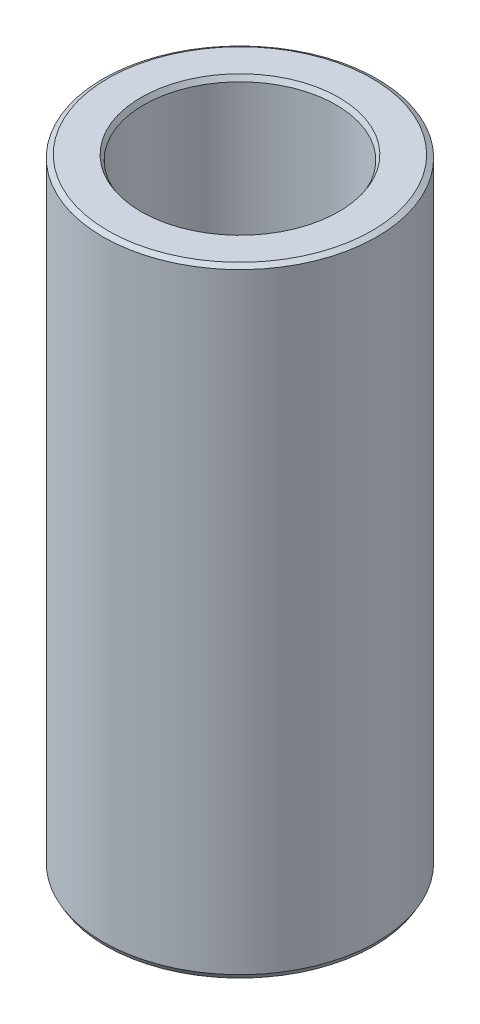
from build123d import *
from OCP.BRepFilletAPI import BRepFilletAPI_MakeChamfer

# Parameters (mm, degrees)
SKETCH1_R           = 42.5
BOSS_EXTRUDE1_DEPTH = 191.894333335
SKETCH2_R           = 29.814766012
CUT_EXTRUDE1_DEPTH  = 202.086884619
CHAMFER1_SIZE       = 0.885749775
CHAMFER1_SIZE2      = 1.534163613


with BuildPart() as part:
    # Sketch1 → Boss-Extrude1 (new body)
    with BuildSketch(Plane(origin=(0, 0, 0), x_dir=(1, 0, 0), z_dir=(0, 1, 0))):
        Circle(SKETCH1_R)
    extrude(amount=BOSS_EXTRUDE1_DEPTH)

    # Sketch2 → Cut-Extrude1 (cut, through all)
    with BuildSketch(Plane(origin=(0, 0, 0), x_dir=(1, 0, 0), z_dir=(0, 1, 0))):
        Circle(SKETCH2_R)
    extrude(amount=CUT_EXTRUDE1_DEPTH, mode=Mode.SUBTRACT)

    # Chamfer1: one chamfer whose edges measure the first distance from different faces: ONE call of the kernel's chamfer builder (chamfer() names one face for all edges)
    chamfer1_edges_1 = [part.edges().sort_by_distance(p)[0] for p in [
        (-29.814766012, 191.894333335, 0),
    ]]
    chamfer1_side_1 = [part.faces().sort_by_distance(p)[0] for p in [
        (-41.297918472, 191.894333335, 0),
    ]]
    chamfer1_edges_2 = [part.edges().sort_by_distance(p)[0] for p in [
        (-29.814766012, 0, 0),
    ]]
    chamfer1_side_2 = [part.faces().sort_by_distance(p)[0] for p in [
        (-29.814766012, 95.947166667, 0),
    ]]
    chamfer1_edges_3 = [part.edges().sort_by_distance(p)[0] for p in [
        (-42.5, 0, 0),
    ]]
    chamfer1_side_3 = [part.faces().sort_by_distance(p)[0] for p in [
        (-41.297918472, 0, 0),
    ]]
    chamfer1_edges_4 = [part.edges().sort_by_distance(p)[0] for p in [
        (-42.5, 191.894333335, 0),
    ]]
    chamfer1_side_4 = [part.faces().sort_by_distance(p)[0] for p in [
        (-42.5, 95.947166667, 0),
    ]]
    chamfer1 = BRepFilletAPI_MakeChamfer(part.part.solid().wrapped)
    for e in chamfer1_edges_1:
        chamfer1.Add(CHAMFER1_SIZE, CHAMFER1_SIZE2, e.wrapped, chamfer1_side_1[0].wrapped)  # the first distance lies on this face
    for e in chamfer1_edges_2:
        chamfer1.Add(CHAMFER1_SIZE, CHAMFER1_SIZE2, e.wrapped, chamfer1_side_2[0].wrapped)  # the first distance lies on this face
    for e in chamfer1_edges_3:
        chamfer1.Add(CHAMFER1_SIZE, CHAMFER1_SIZE2, e.wrapped, chamfer1_side_3[0].wrapped)  # the first distance lies on this face
    for e in chamfer1_edges_4:
        chamfer1.Add(CHAMFER1_SIZE, CHAMFER1_SIZE2, e.wrapped, chamfer1_side_4[0].wrapped)  # the first distance lies on this face
    add(Compound.cast(chamfer1.Shape()), mode=Mode.REPLACE)


solid = part.part
